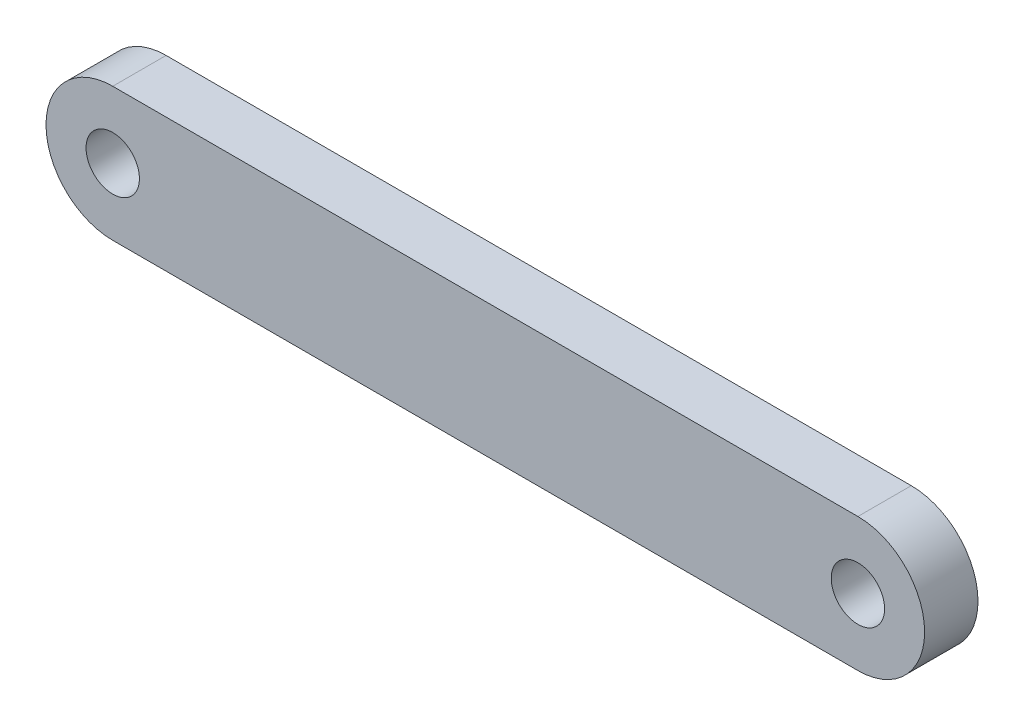
from build123d import *

# Parameters (mm, degrees)
SKETCH1_R           = 1.27
BOSS_EXTRUDE2_DEPTH = 2.54


with BuildPart() as part:
    # Sketch1 → Boss-Extrude2 (new body)
    with BuildSketch(Plane.XY):
        with BuildLine():
            Line((35.4584, 3.175), (0, 3.175))
            ThreePointArc((0, 3.175), (-3.175, 0), (0, -3.175))
            Line((0, -3.175), (35.4584, -3.175))
            ThreePointArc((35.4584, -3.175), (38.6334, 0), (35.4584, 3.175))
        make_face()
        with Locations((35.4584, 0)):
            Circle(SKETCH1_R, mode=Mode.SUBTRACT)
        Circle(SKETCH1_R, mode=Mode.SUBTRACT)
    extrude(amount=BOSS_EXTRUDE2_DEPTH)


solid = part.part
